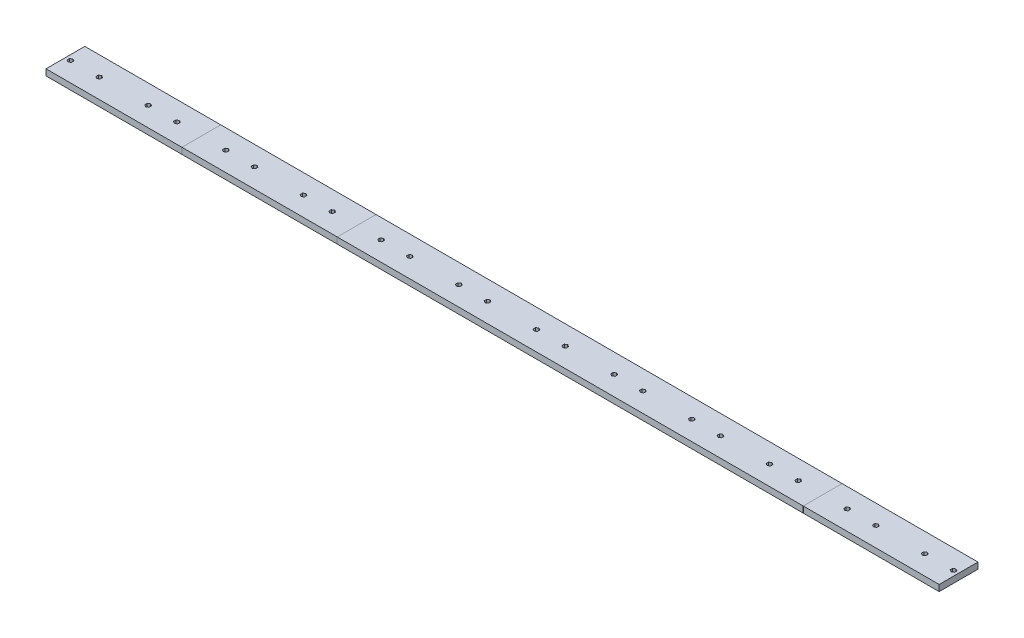
from build123d import *

# Parameters (mm, degrees)
SKETCH_1_W                 = 1150
SKETCH_1_H                 = 50
EXTRUDE_1_DEPTH            = 8
CUT_EXTRUDE_1_DEPTH        = 5
SPLIT_BODIES_1_OUTLINE_W   = 175
SPLIT_BODIES_1_OUTLINE_H   = 50
SPLIT_BODIES_1_DEPTH       = 8
SPLIT_BODIES_1_2_DEPTH     = 3
SPLIT_BODIES_1_3_OUTLINE_W = 600
SPLIT_BODIES_1_3_OUTLINE_H = 50
SPLIT_BODIES_1_3_DEPTH     = 8
SPLIT_BODIES_1_4_DEPTH     = 3
SPLIT_BODIES_1_5_OUTLINE_W = 975
SPLIT_BODIES_1_5_OUTLINE_H = 50
SPLIT_BODIES_1_5_DEPTH     = 8
SPLIT_BODIES_1_6_OUTLINE_W = 200
SPLIT_BODIES_1_6_OUTLINE_H = 50
SPLIT_BODIES_1_6_DEPTH     = 8
SPLIT_BODIES_1_7_DEPTH     = 3


with BuildPart() as part:
    # 스케치1 → 보스-돌출1 (new body)
    with BuildSketch(Plane(origin=(0, 0, 0), x_dir=(1, 0, 0), z_dir=(0, 1, 0))):
        with Locations((575, 25)):
            Rectangle(SKETCH_1_W, SKETCH_1_H)
    extrude(amount=EXTRUDE_1_DEPTH)

    # 스케치2 → 컷-돌출1 (cut)
    with BuildSketch(Plane(origin=(0, 8, 0), x_dir=(1, 0, 0), z_dir=(0, 1, 0))):
        Polygon((106.5, 21.75), (109.314582562, 23.375), (109.314582562, 26.625), (106.5, 28.25), (103.685417438, 26.625), (103.685417438, 23.375), align=None)
        Polygon((6.5, 21.75), (9.314582562, 23.375), (9.314582562, 26.625), (6.5, 28.25), (3.685417438, 26.625), (3.685417438, 23.375), align=None)
        Polygon((43.5, 28.25), (40.685417438, 26.625), (40.685417438, 23.375), (43.5, 21.75), (46.314582562, 23.375), (46.314582562, 26.625), align=None)
        Polygon((143.5, 28.25), (140.685417438, 26.625), (140.685417438, 23.375), (143.5, 21.75), (146.314582562, 23.375), (146.314582562, 26.625), align=None)
        Polygon((206.5, 21.75), (209.314582562, 23.375), (209.314582562, 26.625), (206.5, 28.25), (203.685417438, 26.625), (203.685417438, 23.375), align=None)
        Polygon((243.5, 28.25), (240.685417438, 26.625), (240.685417438, 23.375), (243.5, 21.75), (246.314582562, 23.375), (246.314582562, 26.625), align=None)
        Polygon((306.5, 21.75), (309.314582562, 23.375), (309.314582562, 26.625), (306.5, 28.25), (303.685417438, 26.625), (303.685417438, 23.375), align=None)
        Polygon((343.5, 28.25), (340.685417438, 26.625), (340.685417438, 23.375), (343.5, 21.75), (346.314582562, 23.375), (346.314582562, 26.625), align=None)
        Polygon((406.5, 21.75), (409.314582562, 23.375), (409.314582562, 26.625), (406.5, 28.25), (403.685417438, 26.625), (403.685417438, 23.375), align=None)
        Polygon((443.5, 28.25), (440.685417438, 26.625), (440.685417438, 23.375), (443.5, 21.75), (446.314582562, 23.375), (446.314582562, 26.625), align=None)
        Polygon((506.5, 21.75), (509.314582562, 23.375), (509.314582562, 26.625), (506.5, 28.25), (503.685417438, 26.625), (503.685417438, 23.375), align=None)
        Polygon((543.5, 28.25), (540.685417438, 26.625), (540.685417438, 23.375), (543.5, 21.75), (546.314582562, 23.375), (546.314582562, 26.625), align=None)
        Polygon((606.5, 21.75), (609.314582562, 23.375), (609.314582562, 26.625), (606.5, 28.25), (603.685417438, 26.625), (603.685417438, 23.375), align=None)
        Polygon((643.5, 28.25), (640.685417438, 26.625), (640.685417438, 23.375), (643.5, 21.75), (646.314582562, 23.375), (646.314582562, 26.625), align=None)
        Polygon((706.5, 21.75), (709.314582562, 23.375), (709.314582562, 26.625), (706.5, 28.25), (703.685417438, 26.625), (703.685417438, 23.375), align=None)
        Polygon((743.5, 28.25), (740.685417438, 26.625), (740.685417438, 23.375), (743.5, 21.75), (746.314582562, 23.375), (746.314582562, 26.625), align=None)
        Polygon((806.5, 21.75), (809.314582562, 23.375), (809.314582562, 26.625), (806.5, 28.25), (803.685417438, 26.625), (803.685417438, 23.375), align=None)
        Polygon((843.5, 28.25), (840.685417438, 26.625), (840.685417438, 23.375), (843.5, 21.75), (846.314582562, 23.375), (846.314582562, 26.625), align=None)
        Polygon((906.5, 21.75), (909.314582562, 23.375), (909.314582562, 26.625), (906.5, 28.25), (903.685417438, 26.625), (903.685417438, 23.375), align=None)
        Polygon((943.5, 28.25), (940.685417438, 26.625), (940.685417438, 23.375), (943.5, 21.75), (946.314582562, 23.375), (946.314582562, 26.625), align=None)
        Polygon((1006.5, 21.75), (1009.314582562, 23.375), (1009.314582562, 26.625), (1006.5, 28.25), (1003.685417438, 26.625), (1003.685417438, 23.375), align=None)
        Polygon((1043.5, 28.25), (1040.685417438, 26.625), (1040.685417438, 23.375), (1043.5, 21.75), (1046.314582562, 23.375), (1046.314582562, 26.625), align=None)
        Polygon((1106.5, 21.75), (1109.314582562, 23.375), (1109.314582562, 26.625), (1106.5, 28.25), (1103.685417438, 26.625), (1103.685417438, 23.375), align=None)
        Polygon((1143.5, 28.25), (1140.685417438, 26.625), (1140.685417438, 23.375), (1143.5, 21.75), (1146.314582562, 23.375), (1146.314582562, 26.625), align=None)
    extrude(amount=-CUT_EXTRUDE_1_DEPTH, mode=Mode.SUBTRACT)

    # Split Bodies 1 5 outline → Split Bodies 1 5 (cut)
    with BuildSketch(Plane(origin=(0, 0, 0), x_dir=(1, 0, 0), z_dir=(0, 1, 0))):
        with Locations((487.5, 25)):
            Rectangle(SPLIT_BODIES_1_5_OUTLINE_W, SPLIT_BODIES_1_5_OUTLINE_H)
    extrude(amount=SPLIT_BODIES_1_5_DEPTH, mode=Mode.SUBTRACT)


with BuildPart() as body_2:
    # Split Bodies 1: read off the stored shape, not the designer's step
    # Split Bodies 1 outline → Split Bodies 1 (new body)
    with BuildSketch(Plane(origin=(0, 0, 0), x_dir=(1, 0, 0), z_dir=(0, 1, 0))):
        with Locations((87.5, 25)):
            Rectangle(SPLIT_BODIES_1_OUTLINE_W, SPLIT_BODIES_1_OUTLINE_H)
        Polygon((6.5, 21.75), (3.685417438, 23.375), (3.685417438, 26.625), (6.5, 28.25), (9.314582562, 26.625), (9.314582562, 23.375), align=None, mode=Mode.SUBTRACT)
        Polygon((43.5, 28.25), (46.314582562, 26.625), (46.314582562, 23.375), (43.5, 21.75), (40.685417438, 23.375), (40.685417438, 26.625), align=None, mode=Mode.SUBTRACT)
        Polygon((106.5, 21.75), (103.685417438, 23.375), (103.685417438, 26.625), (106.5, 28.25), (109.314582562, 26.625), (109.314582562, 23.375), align=None, mode=Mode.SUBTRACT)
        Polygon((143.5, 28.25), (146.314582562, 26.625), (146.314582562, 23.375), (143.5, 21.75), (140.685417438, 23.375), (140.685417438, 26.625), align=None, mode=Mode.SUBTRACT)
    extrude(amount=SPLIT_BODIES_1_DEPTH)

    # Split Bodies 1 2 outline → Split Bodies 1 2 (add)
    with BuildSketch(Plane(origin=(0, 0, 0), x_dir=(1, 0, 0), z_dir=(0, 1, 0))):
        Polygon((146.314582562, 23.375), (146.314582562, 26.625), (143.5, 28.25), (140.685417438, 26.625), (140.685417438, 23.375), (143.5, 21.75), align=None)
        Polygon((103.685417438, 26.625), (103.685417438, 23.375), (106.5, 21.75), (109.314582562, 23.375), (109.314582562, 26.625), (106.5, 28.25), align=None)
        Polygon((46.314582562, 23.375), (46.314582562, 26.625), (43.5, 28.25), (40.685417438, 26.625), (40.685417438, 23.375), (43.5, 21.75), align=None)
        Polygon((3.685417438, 26.625), (3.685417438, 23.375), (6.5, 21.75), (9.314582562, 23.375), (9.314582562, 26.625), (6.5, 28.25), align=None)
    extrude(amount=SPLIT_BODIES_1_2_DEPTH)


with BuildPart() as body_3:
    # Split Bodies 1 3 outline → Split Bodies 1 3 (new body)
    with BuildSketch(Plane(origin=(0, 0, 0), x_dir=(1, 0, 0), z_dir=(0, 1, 0))):
        with Locations((675, 25)):
            Rectangle(SPLIT_BODIES_1_3_OUTLINE_W, SPLIT_BODIES_1_3_OUTLINE_H)
        Polygon((409.314582562, 26.625), (409.314582562, 23.375), (406.5, 21.75), (403.685417438, 23.375), (403.685417438, 26.625), (406.5, 28.25), align=None, mode=Mode.SUBTRACT)
        Polygon((440.685417438, 23.375), (440.685417438, 26.625), (443.5, 28.25), (446.314582562, 26.625), (446.314582562, 23.375), (443.5, 21.75), align=None, mode=Mode.SUBTRACT)
        Polygon((509.314582562, 26.625), (509.314582562, 23.375), (506.5, 21.75), (503.685417438, 23.375), (503.685417438, 26.625), (506.5, 28.25), align=None, mode=Mode.SUBTRACT)
        Polygon((540.685417438, 23.375), (540.685417438, 26.625), (543.5, 28.25), (546.314582562, 26.625), (546.314582562, 23.375), (543.5, 21.75), align=None, mode=Mode.SUBTRACT)
        Polygon((609.314582562, 26.625), (609.314582562, 23.375), (606.5, 21.75), (603.685417438, 23.375), (603.685417438, 26.625), (606.5, 28.25), align=None, mode=Mode.SUBTRACT)
        Polygon((640.685417438, 23.375), (640.685417438, 26.625), (643.5, 28.25), (646.314582562, 26.625), (646.314582562, 23.375), (643.5, 21.75), align=None, mode=Mode.SUBTRACT)
        Polygon((709.314582562, 26.625), (709.314582562, 23.375), (706.5, 21.75), (703.685417438, 23.375), (703.685417438, 26.625), (706.5, 28.25), align=None, mode=Mode.SUBTRACT)
        Polygon((740.685417438, 23.375), (740.685417438, 26.625), (743.5, 28.25), (746.314582562, 26.625), (746.314582562, 23.375), (743.5, 21.75), align=None, mode=Mode.SUBTRACT)
        Polygon((809.314582562, 26.625), (809.314582562, 23.375), (806.5, 21.75), (803.685417438, 23.375), (803.685417438, 26.625), (806.5, 28.25), align=None, mode=Mode.SUBTRACT)
        Polygon((840.685417438, 23.375), (840.685417438, 26.625), (843.5, 28.25), (846.314582562, 26.625), (846.314582562, 23.375), (843.5, 21.75), align=None, mode=Mode.SUBTRACT)
        Polygon((909.314582562, 26.625), (909.314582562, 23.375), (906.5, 21.75), (903.685417438, 23.375), (903.685417438, 26.625), (906.5, 28.25), align=None, mode=Mode.SUBTRACT)
        Polygon((940.685417438, 23.375), (940.685417438, 26.625), (943.5, 28.25), (946.314582562, 26.625), (946.314582562, 23.375), (943.5, 21.75), align=None, mode=Mode.SUBTRACT)
    extrude(amount=SPLIT_BODIES_1_3_DEPTH)

    # Split Bodies 1 4 outline → Split Bodies 1 4 (add)
    with BuildSketch(Plane(origin=(0, 0, 0), x_dir=(1, 0, 0), z_dir=(0, 1, 0))):
        Polygon((806.5, 21.75), (809.314582562, 23.375), (809.314582562, 26.625), (806.5, 28.25), (803.685417438, 26.625), (803.685417438, 23.375), align=None)
        Polygon((843.5, 28.25), (840.685417438, 26.625), (840.685417438, 23.375), (843.5, 21.75), (846.314582562, 23.375), (846.314582562, 26.625), align=None)
        Polygon((906.5, 21.75), (909.314582562, 23.375), (909.314582562, 26.625), (906.5, 28.25), (903.685417438, 26.625), (903.685417438, 23.375), align=None)
        Polygon((943.5, 28.25), (940.685417438, 26.625), (940.685417438, 23.375), (943.5, 21.75), (946.314582562, 23.375), (946.314582562, 26.625), align=None)
        Polygon((606.5, 21.75), (609.314582562, 23.375), (609.314582562, 26.625), (606.5, 28.25), (603.685417438, 26.625), (603.685417438, 23.375), align=None)
        Polygon((643.5, 28.25), (640.685417438, 26.625), (640.685417438, 23.375), (643.5, 21.75), (646.314582562, 23.375), (646.314582562, 26.625), align=None)
        Polygon((706.5, 21.75), (709.314582562, 23.375), (709.314582562, 26.625), (706.5, 28.25), (703.685417438, 26.625), (703.685417438, 23.375), align=None)
        Polygon((743.5, 28.25), (740.685417438, 26.625), (740.685417438, 23.375), (743.5, 21.75), (746.314582562, 23.375), (746.314582562, 26.625), align=None)
        Polygon((406.5, 21.75), (409.314582562, 23.375), (409.314582562, 26.625), (406.5, 28.25), (403.685417438, 26.625), (403.685417438, 23.375), align=None)
        Polygon((443.5, 28.25), (440.685417438, 26.625), (440.685417438, 23.375), (443.5, 21.75), (446.314582562, 23.375), (446.314582562, 26.625), align=None)
        Polygon((506.5, 21.75), (509.314582562, 23.375), (509.314582562, 26.625), (506.5, 28.25), (503.685417438, 26.625), (503.685417438, 23.375), align=None)
        Polygon((543.5, 28.25), (540.685417438, 26.625), (540.685417438, 23.375), (543.5, 21.75), (546.314582562, 23.375), (546.314582562, 26.625), align=None)
    extrude(amount=SPLIT_BODIES_1_4_DEPTH)


with BuildPart() as body_4:
    # Split Bodies 1 6 outline → Split Bodies 1 6 (new body)
    with BuildSketch(Plane(origin=(0, 0, 0), x_dir=(1, 0, 0), z_dir=(0, 1, 0))):
        with Locations((275, 25)):
            Rectangle(SPLIT_BODIES_1_6_OUTLINE_W, SPLIT_BODIES_1_6_OUTLINE_H)
        Polygon((209.314582562, 26.625), (209.314582562, 23.375), (206.5, 21.75), (203.685417438, 23.375), (203.685417438, 26.625), (206.5, 28.25), align=None, mode=Mode.SUBTRACT)
        Polygon((240.685417438, 23.375), (240.685417438, 26.625), (243.5, 28.25), (246.314582562, 26.625), (246.314582562, 23.375), (243.5, 21.75), align=None, mode=Mode.SUBTRACT)
        Polygon((309.314582562, 26.625), (309.314582562, 23.375), (306.5, 21.75), (303.685417438, 23.375), (303.685417438, 26.625), (306.5, 28.25), align=None, mode=Mode.SUBTRACT)
        Polygon((340.685417438, 23.375), (340.685417438, 26.625), (343.5, 28.25), (346.314582562, 26.625), (346.314582562, 23.375), (343.5, 21.75), align=None, mode=Mode.SUBTRACT)
    extrude(amount=SPLIT_BODIES_1_6_DEPTH)

    # Split Bodies 1 7 outline → Split Bodies 1 7 (add)
    with BuildSketch(Plane(origin=(0, 0, 0), x_dir=(1, 0, 0), z_dir=(0, 1, 0))):
        Polygon((206.5, 21.75), (209.314582562, 23.375), (209.314582562, 26.625), (206.5, 28.25), (203.685417438, 26.625), (203.685417438, 23.375), align=None)
        Polygon((243.5, 28.25), (240.685417438, 26.625), (240.685417438, 23.375), (243.5, 21.75), (246.314582562, 23.375), (246.314582562, 26.625), align=None)
        Polygon((306.5, 21.75), (309.314582562, 23.375), (309.314582562, 26.625), (306.5, 28.25), (303.685417438, 26.625), (303.685417438, 23.375), align=None)
        Polygon((343.5, 28.25), (340.685417438, 26.625), (340.685417438, 23.375), (343.5, 21.75), (346.314582562, 23.375), (346.314582562, 26.625), align=None)
    extrude(amount=SPLIT_BODIES_1_7_DEPTH)


solid = Compound([part.part, body_2.part, body_3.part, body_4.part])
